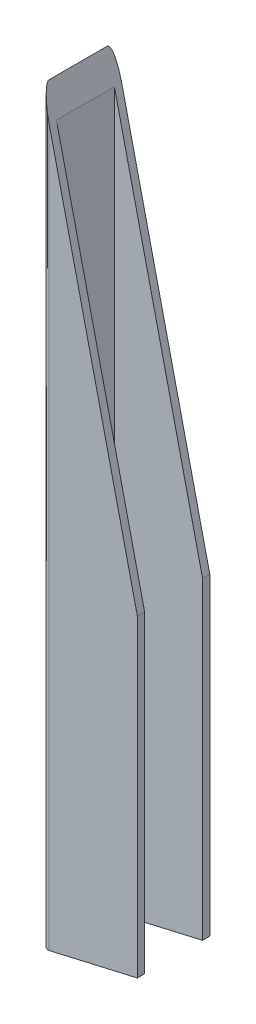
from build123d import *

# Parameters (mm, degrees)
SKETCH_1_W          = 74
SKETCH_1_H          = 24
EXTRUDE_1_DEPTH     = 310
SKETCH_2_W          = 41.646480438
SKETCH_2_H          = 42.526894273
CUT_EXTRUDE_1_DEPTH = 313.929704566
SKETCH_3_OUTSIDE_W  = 104.288
SKETCH_3_OUTSIDE_H  = 374.788
CUT_EXTRUDE_2_DEPTH = 315.006369362


with BuildPart() as part:
    # Эскиз1 → Вытянуть-Тонкостенный1 (new body)
    with BuildSketch(Plane(origin=(0, 0, 0), x_dir=(1, 0, 0), z_dir=(0, 1, 0))):
        with BuildLine():
            Line((40, 12), (40, -12))
            ThreePointArc((40, -12), (39.121320344, -14.121320344), (37, -15))
            Line((37, -15), (-37, -15))
            ThreePointArc((-37, -15), (-39.121320344, -14.121320344), (-40, -12))
            Line((-40, -12), (-40, 12))
            ThreePointArc((-40, 12), (-39.121320344, 14.121320344), (-37, 15))
            Line((-37, 15), (37, 15))
            ThreePointArc((37, 15), (39.121320344, 14.121320344), (40, 12))
        make_face()
        Rectangle(SKETCH_1_W, SKETCH_1_H, mode=Mode.SUBTRACT)
    extrude(amount=EXTRUDE_1_DEPTH)

    # Эскиз2 → Вырез-Вытянуть1 (cut, through all)
    with BuildSketch(Plane(origin=(0, 310, 0), x_dir=(1, 0, 0), z_dir=(0, 1, 0))):
        with Locations((20.323240219, -0.290673418)):
            Rectangle(SKETCH_2_W, SKETCH_2_H)
    extrude(amount=-CUT_EXTRUDE_1_DEPTH, mode=Mode.SUBTRACT)

    # Эскиз3 outside → Вырез-Вытянуть2 (cut, through all)
    with BuildSketch(Plane.XY.offset(15)):
        with Locations((-20.25, 155)):
            Rectangle(SKETCH_3_OUTSIDE_W, SKETCH_3_OUTSIDE_H)
        Polygon((-40, 310), (-0.5, 138.906702966), (-0.5, 9.119293549), (-40, 0), align=None, mode=Mode.SUBTRACT)
    extrude(amount=-CUT_EXTRUDE_2_DEPTH, mode=Mode.SUBTRACT)


solid = part.part
